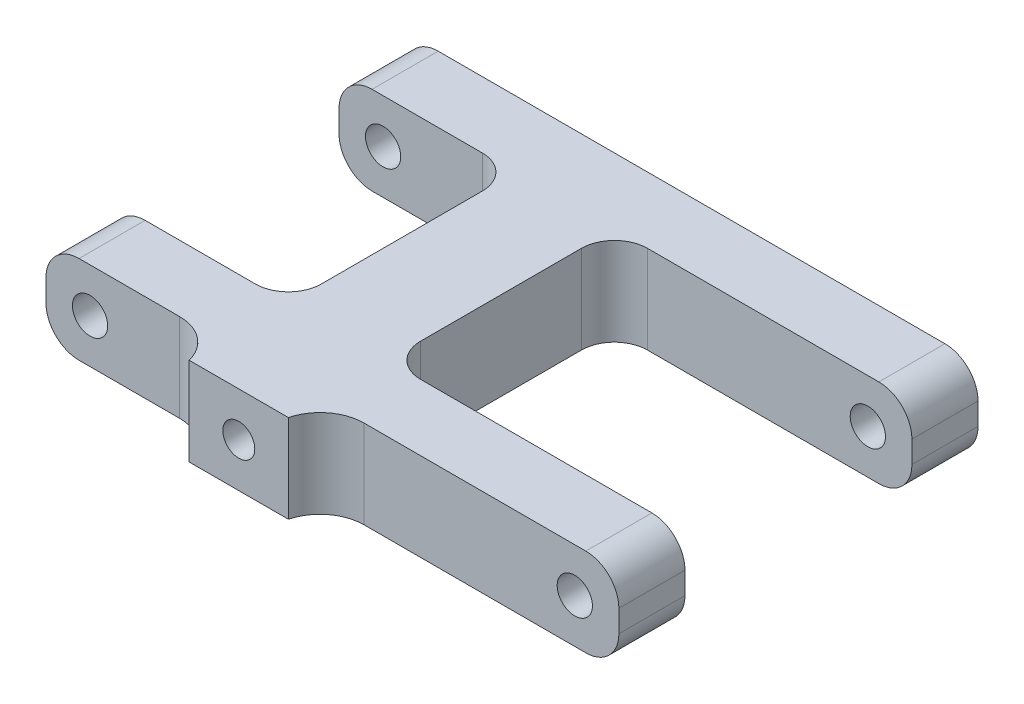
from build123d import *

# Parameters (mm, degrees)
SKETCH1_W               = 52
SKETCH1_H               = 32.6
BOSS_EXTRUDE1_DEPTH     = 8
SKETCH2_W               = 20.6
SKETCH2_H               = 8
CUT_EXTRUDE1_DEPTH      = 27
SKETCH3_W               = 20.6
SKETCH3_H               = 8
CUT_EXTRUDE2_DEPTH      = 16
SKETCH5_R               = 1.6
CUT_EXTRUDE4_DEPTH      = 62.893133706
FILLET1_R               = 3
FILLET2_R               = 3
SKETCH8_W               = 9
SKETCH8_H               = 8
BOSS_EXTRUDE2_DEPTH     = 3
CUT_EXTRUDE5_DEPTH      = 4
CUT_EXTRUDE5_DEPTH_BACK = 15
SKETCH6_R               = 1.45
FILLET3_R               = 4


with BuildPart() as part:
    # Sketch1 → Boss-Extrude1 (new body)
    with BuildSketch(Plane(origin=(0, 0, 0), x_dir=(1, 0, 0), z_dir=(0, 1, 0))):
        with Locations((26, -16.3)):
            Rectangle(SKETCH1_W, SKETCH1_H)
    extrude(amount=BOSS_EXTRUDE1_DEPTH)

    # Sketch2 → Cut-Extrude1 (cut)
    with BuildSketch(Plane(origin=(52, 0, 0), x_dir=(0, 0, -1), z_dir=(1, 0, 0))):
        with Locations((-16.3, 4)):
            Rectangle(SKETCH2_W, SKETCH2_H)
    extrude(amount=-CUT_EXTRUDE1_DEPTH, mode=Mode.SUBTRACT)

    # Sketch3 → Cut-Extrude2 (cut)
    with BuildSketch(Plane.ZY):
        with Locations((16.3, 4)):
            Rectangle(SKETCH3_W, SKETCH3_H)
    extrude(amount=-CUT_EXTRUDE2_DEPTH, mode=Mode.SUBTRACT)

    # Sketch5 → Cut-Extrude4 (cut, through all)
    with BuildSketch(Plane.XY.offset(32.6)):
        with Locations((4, 4)):
            Circle(SKETCH5_R)
        with Locations((48, 4)):
            Circle(SKETCH5_R)
    extrude(amount=-CUT_EXTRUDE4_DEPTH, mode=Mode.SUBTRACT)

    # Fillet1
    fillet1_edges = [part.edges().sort_by_distance(p)[0] for p in [
        (52, 8, 29.6),
        (52, 0, 3),
        (52, 8, 3),
        (0, 0, 29.6),
        (0, 8, 29.6),
        (0, 8, 3),
        (52, 0, 29.6),
        (0, 0, 3),
    ]]
    fillet(fillet1_edges, radius=FILLET1_R)

    # Fillet2
    fillet2_edges = [part.edges().sort_by_distance(p)[0] for p in [
        (25, 4, 26.6),
        (25, 4, 6),
        (16, 4, 6),
        (16, 4, 26.6),
    ]]
    fillet(fillet2_edges, radius=FILLET2_R)

    # Sketch8 → Boss-Extrude2 (add)
    with BuildSketch(Plane.XY.offset(32.6)):
        with Locations((20.5, 4)):
            Rectangle(SKETCH8_W, SKETCH8_H)
    extrude(amount=BOSS_EXTRUDE2_DEPTH)

    # Sketch6 → Cut-Extrude5 (cut, two sides: drawn at the far end of the back side and taken through both)
    with BuildSketch(Plane.XY.offset(32.6).offset(-CUT_EXTRUDE5_DEPTH_BACK)):
        with Locations((20.5, 4)):
            Circle(SKETCH6_R)
    extrude(amount=CUT_EXTRUDE5_DEPTH + CUT_EXTRUDE5_DEPTH_BACK, mode=Mode.SUBTRACT)

    # Fillet3
    # the kernel refuses this fillet: 4 mm, written as the material it adds along each edge
    with BuildSketch(Plane(origin=(25, 8, 32.6), x_dir=(0, 0, 1), z_dir=(0, -1, 0))) as fillet3_piece_1:
        with BuildLine():
            CenterArc((4, -3.872983346), FILLET3_R, 104.477512186, 75.522487814)
            Line((0, -3.872983346), (-0.08, -3.872983346))
            Line((-0.08, -3.872983346), (-0.08, 0))
            Line((-0.08, 0), (0, 0.08))
            ThreePointArc((0, 0.08), (1.5, 0.08), (2.98, 0.077459667))
            Line((2.98, 0.077459667), (3, 0))
        make_face()
    extrude(amount=8)
    with BuildSketch(Plane(origin=(16, 0, 32.6), x_dir=(-1, 0, 0), z_dir=(0, 1, 0))) as fillet3_piece_2:
        with BuildLine():
            CenterArc((3.872983346, 4), FILLET3_R, 194.477512186, 75.522487814)
            Line((0, 3), (-0.077459667, 2.98))
            ThreePointArc((-0.077459667, 2.98), (-0.08, 1.5), (-0.08, 0))
            Line((-0.08, 0), (0, -0.08))
            Line((0, -0.08), (3.872983346, -0.08))
            Line((3.872983346, -0.08), (3.872983346, 0))
        make_face()
    extrude(amount=8)


solid = part.part
